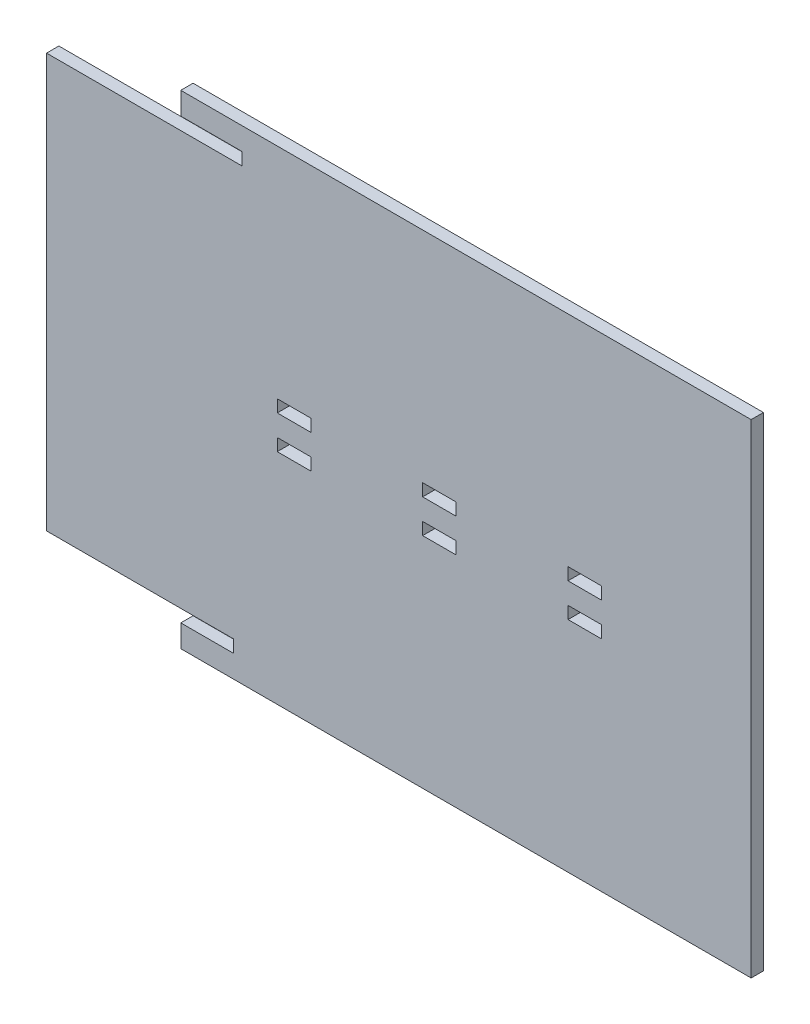
from build123d import *

# Parameters (mm, degrees)
SALIENTE_EXTRUIR1_DEPTH = 5.5
CROQUIS2_W              = 15
CROQUIS2_H              = 5.5
CORTAR_EXTRUIR2_DEPTH   = 5.5


with BuildPart() as part:
    # Croquis1 → Saliente-Extruir1 (new body)
    with BuildSketch(Plane.XY):
        Polygon((27.526079374, 0.1), (27.526079374, -216.1), (-227.473920626, -216.1), (-227.473920626, -206.1), (-203.831058672, -206.1), (-203.831058672, -200.5), (-287.473920626, -200.5), (-287.473920626, -15.5), (-200, -15.5), (-200, -9.9), (-227.473920626, -9.9), (-227.473920626, 0.1), align=None)
    extrude(amount=SALIENTE_EXTRUIR1_DEPTH)

    # Croquis2 → Cortar-Extruir2 (cut)
    with BuildSketch(Plane.XY.offset(5.5)):
        with Locations((-46.837001408, -115.5)):
            Rectangle(CROQUIS2_W, CROQUIS2_H)
        with Locations((-111.837001408, -100.5)):
            Rectangle(CROQUIS2_W, CROQUIS2_H)
        with Locations((-176.837001408, -100.5)):
            Rectangle(CROQUIS2_W, CROQUIS2_H)
        with Locations((-46.837001408, -100.5)):
            Rectangle(CROQUIS2_W, CROQUIS2_H)
        with Locations((-111.837001408, -115.5)):
            Rectangle(CROQUIS2_W, CROQUIS2_H)
        with Locations((-176.837001408, -115.5)):
            Rectangle(CROQUIS2_W, CROQUIS2_H)
    extrude(amount=-CORTAR_EXTRUIR2_DEPTH, mode=Mode.SUBTRACT)


solid = part.part
